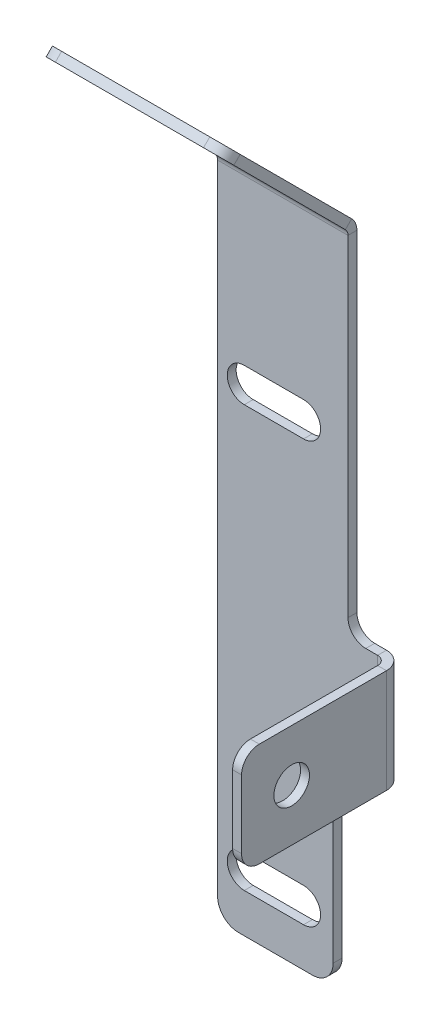
from build123d import *

# Parameters (mm, degrees)
BASE_FLANGE1_DEPTH     = 3
CUT_EXTRUDE1_DEPTH     = 10
SKETCHED_START         = 179.903820644
SKETCHED_BEND1_DEPTH   = 9.096179356
SKETCHED_START_2       = -37
SKETCHED_BEND1_2_DEPTH = 62
SKETCHED_START_3       = -19
SKETCHED_BEND1_3_DEPTH = 44
SKETCHED_START_4       = -10.35
SKETCHED_BEND1_4_DEPTH = 20
SKETCHED_START_5       = -31
SKETCHED_BEND1_5_DEPTH = 12.65
SKETCHED_START_6       = 17.65
SKETCHED_BEND1_6_DEPTH = 1.35
SKETCHED_START_7       = 142.46468863
SKETCHED_BEND1_7_DEPTH = 2.999999999
SKETCHED_START_8       = 50.5
SKETCHED_BEND2_DEPTH   = 35
SKETCHED_BEND2_2_DEPTH = 35
SKETCHED_START_9       = 31
SKETCHED_BEND2_3_DEPTH = 11
SKETCH9_R              = 6
CUT_EXTRUDE2_DEPTH     = 10
CUT_EXTRUDE3_DEPTH     = 10


with BuildPart() as part:
    # Base-Flange1: sheet metal written as solids
    # Sketch1 → Base-Flange1 (new body)
    with BuildSketch(Plane(origin=(0, 0, 0), x_dir=(0, 1, 0), z_dir=(0, 0, 1))):
        with BuildLine():
            Line((-19, 12), (-19, -13))
            ThreePointArc((-19, -13), (-16.949747468, -17.949747468), (-12, -20))
            Line((-12, -20), (43.5, -20))
            ThreePointArc((43.5, -20), (48.449747468, -22.050252532), (50.5, -27))
            Line((50.5, -27), (50.5, -85))
            ThreePointArc((50.5, -85), (52.257359313, -89.242640687), (56.5, -91))
            Line((56.5, -91), (79.5, -91))
            ThreePointArc((79.5, -91), (83.742640687, -89.242640687), (85.5, -85))
            Line((85.5, -85), (85.5, -31))
            ThreePointArc((85.5, -31), (87.257359313, -26.757359313), (91.5, -25))
            Line((91.5, -25), (260, -25))
            ThreePointArc((260, -25), (264.242640687, -23.242640687), (266, -19))
            Line((266, -19), (266, 31))
            ThreePointArc((266, 31), (264.242640687, 35.242640687), (260, 37))
            Line((260, 37), (240.82, 37))
            ThreePointArc((240.82, 37), (236.577359313, 35.242640687), (234.82, 31))
            Line((234.82, 31), (234.82, 25))
            ThreePointArc((234.82, 25), (233.062640687, 20.757359313), (228.82, 19))
            Line((228.82, 19), (-12, 19))
            ThreePointArc((-12, 19), (-16.949747468, 16.949747468), (-19, 12))
        make_face()
    extrude(amount=BASE_FLANGE1_DEPTH)

    # Sketch6 → Cut-Extrude1 (cut)
    with BuildSketch(Plane.XY.offset(3)):
        with BuildLine():
            Line((9.65, 243), (9.65, 258))
            ThreePointArc((9.65, 258), (13.65, 262), (17.65, 258))
            Line((17.65, 258), (17.65, 243))
            ThreePointArc((17.65, 243), (13.65, 239), (9.65, 243))
        make_face()
        with BuildLine():
            Line((-18.35, 243), (-18.35, 258))
            ThreePointArc((-18.35, 258), (-14.35, 262), (-10.35, 258))
            Line((-10.35, 258), (-10.35, 243))
            ThreePointArc((-10.35, 243), (-14.35, 239), (-18.35, 243))
        make_face()
    extrude(amount=-CUT_EXTRUDE1_DEPTH, mode=Mode.SUBTRACT)

    # Sketched Bend1: read off the stored shape, not the designer's step
    # Sketched Bend1 outline → Sketched Bend1 (cut)
    with BuildSketch(Plane(origin=(0, 0, 0), x_dir=(1, 0, 0), z_dir=(0, 0.707106781186549, -0.707106781186546)).offset(SKETCHED_START)):
        with BuildLine():
            Line((9.65, -184.182824136), (9.65, -199.182824136))
            ThreePointArc((9.65, -199.182824136), (13.65, -203.182824136), (17.65, -199.182824136))
            Line((17.65, -199.182824136), (17.65, -184.182824136))
            ThreePointArc((17.65, -184.182824136), (13.65, -180.182824136), (9.65, -184.182824136))
        make_face()
        with BuildLine():
            Line((-18.35, -184.182824136), (-18.35, -199.182824136))
            ThreePointArc((-18.35, -199.182824136), (-14.35, -203.182824136), (-10.35, -199.182824136))
            Line((-10.35, -199.182824136), (-10.35, -184.182824136))
            ThreePointArc((-10.35, -184.182824136), (-14.35, -180.182824136), (-18.35, -184.182824136))
        make_face()
    extrude(amount=SKETCHED_BEND1_DEPTH, mode=Mode.SUBTRACT)

    # Sketched Bend1 2 outline → Sketched Bend1 2 (cut)
    with BuildSketch(Plane.YZ.offset(SKETCHED_START_2)):
        with BuildLine():
            Line((208.718135506, 3), (207.475494819, 1.757359313))
            ThreePointArc((207.475494819, 1.757359313), (205.528954726, 0.456722805), (203.232854132, 0))
            Line((203.232854132, 0), (266, 0))
            Line((266, 0), (266, 3))
            Line((266, 3), (208.718135506, 3))
        make_face()
    extrude(amount=SKETCHED_BEND1_2_DEPTH, mode=Mode.SUBTRACT)

    # Sketched Bend1 3 outline → Sketched Bend1 3 (add)
    with BuildSketch(Plane.YZ.offset(SKETCHED_START_3)):
        with BuildLine():
            Line((225.190537865, 23.715043045), (205.354174476, 3.878679656))
            ThreePointArc((205.354174476, 3.878679656), (204.380904429, 3.228361402), (203.232854132, 3))
            Line((203.232854132, 3), (208.718135506, 3))
            Line((208.718135506, 3), (227.311858208, 21.593722702))
            Line((227.311858208, 21.593722702), (225.190537865, 23.715043045))
        make_face()
    extrude(amount=SKETCHED_BEND1_3_DEPTH)

    # Sketched Bend1 4 outline → Sketched Bend1 4 (add)
    with BuildSketch(Plane.YZ.offset(SKETCHED_START_4)):
        Polygon((247.238127302, 45.762632482), (225.190537865, 23.715043045), (227.311858208, 21.593722702), (249.359447645, 43.641312139), align=None)
    extrude(amount=SKETCHED_BEND1_4_DEPTH)

    # Sketched Bend1 5 outline → Sketched Bend1 5 (add)
    with BuildSketch(Plane.YZ.offset(SKETCHED_START_5)):
        Polygon((247.238127302, 45.762632482), (225.190537865, 23.715043045), (227.311858208, 21.593722702), (249.359447645, 43.641312139), align=None)
    extrude(amount=SKETCHED_BEND1_5_DEPTH)

    # Sketched Bend1 6 outline → Sketched Bend1 6 (add)
    with BuildSketch(Plane.YZ.offset(SKETCHED_START_6)):
        Polygon((247.238127302, 45.762632482), (225.190537865, 23.715043045), (227.311858208, 21.593722702), (249.359447645, 43.641312139), align=None)
    extrude(amount=SKETCHED_BEND1_6_DEPTH)

    # Sketched Bend1 7 outline → Sketched Bend1 7 (add)
    with BuildSketch(Plane(origin=(0, 0, 0), x_dir=(1, 0, 0), z_dir=(0, 0.707106781186549, -0.707106781186546)).offset(SKETCHED_START_7)):
        with BuildLine():
            ThreePointArc((-19, -170.002824136), (-20.757359313, -174.245464823), (-25, -176.002824136))
            Line((-25, -176.002824136), (-19, -176.002824137))
            Line((-19, -176.002824137), (-19, -170.002824136))
        make_face()
        with BuildLine():
            ThreePointArc((-37, -201.182824136), (-35.242640687, -205.425464823), (-31, -207.182824136))
            Line((-31, -207.182824136), (-31, -176.002824136))
            ThreePointArc((-31, -176.002824136), (-35.242640687, -177.760183449), (-37, -182.002824136))
            Line((-37, -182.002824136), (-37, -201.182824136))
        make_face()
        with BuildLine():
            Line((-18.35, -207.182824136), (-10.35, -207.182824136))
            Line((-10.35, -207.182824136), (-10.35, -199.182824136))
            ThreePointArc((-10.35, -199.182824136), (-14.35, -203.182824136), (-18.35, -199.182824136))
            Line((-18.35, -199.182824136), (-18.35, -207.182824136))
        make_face()
        with BuildLine():
            Line((9.65, -207.182824136), (17.65, -207.182824136))
            Line((17.65, -207.182824136), (17.65, -199.182824136))
            ThreePointArc((17.65, -199.182824136), (13.65, -203.182824136), (9.65, -199.182824136))
            Line((9.65, -199.182824136), (9.65, -207.182824136))
        make_face()
        with BuildLine():
            Line((25, -201.182824136), (25, -176.002824137))
            Line((25, -176.002824137), (19, -176.002824137))
            Line((19, -176.002824137), (19, -207.182824136))
            ThreePointArc((19, -207.182824136), (23.242640687, -205.425464823), (25, -201.182824136))
        make_face()
        with BuildLine():
            ThreePointArc((9.65, -184.182824136), (13.65, -180.182824136), (17.65, -184.182824136))
            Line((17.65, -184.182824136), (17.65, -176.002824137))
            Line((17.65, -176.002824137), (9.65, -176.002824137))
            Line((9.65, -176.002824137), (9.65, -184.182824136))
        make_face()
        with BuildLine():
            ThreePointArc((-18.35, -184.182824136), (-14.35, -180.182824136), (-10.35, -184.182824136))
            Line((-10.35, -184.182824136), (-10.35, -176.002824137))
            Line((-10.35, -176.002824137), (-18.35, -176.002824137))
            Line((-18.35, -176.002824137), (-18.35, -184.182824136))
        make_face()
    extrude(amount=SKETCHED_BEND1_7_DEPTH)

    # Sketched Bend2: read off the stored shape, not the designer's step
    # Sketched Bend2 outline → Sketched Bend2 (cut)
    with BuildSketch(Plane(origin=(0, 0, 0), x_dir=(1, 0, 0), z_dir=(0, 1, 0)).offset(SKETCHED_START_8)):
        with BuildLine():
            ThreePointArc((35, 0), (38, -0.803847577), (40.196152423, -3))
            Line((40.196152423, -3), (91, -3))
            Line((91, -3), (91, 0))
            Line((91, 0), (35, 0))
        make_face()
    extrude(amount=SKETCHED_BEND2_DEPTH, mode=Mode.SUBTRACT)

    # Sketched Bend2 2 outline → Sketched Bend2 2 (add)
    with BuildSketch(Plane(origin=(0, 0, 0), x_dir=(1, 0, 0), z_dir=(0, 1, 0)).offset(SKETCHED_START_8)):
        with BuildLine():
            ThreePointArc((35, -3), (37.121320344, -3.878679656), (38, -6))
            Line((38, -6), (38, -54.931416529))
            Line((38, -54.931416529), (41, -54.931416529))
            Line((41, -54.931416529), (41, -6))
            ThreePointArc((41, -6), (40.795554958, -4.447085729), (40.196152423, -3))
            Line((40.196152423, -3), (35, -3))
        make_face()
    extrude(amount=SKETCHED_BEND2_2_DEPTH)

    # Sketched Bend2 3 outline → Sketched Bend2 3 (cut)
    with BuildSketch(Plane.YZ.offset(SKETCHED_START_9)):
        with BuildLine():
            ThreePointArc((50.5, 48.931416529), (52.257359313, 53.174057216), (56.5, 54.931416529))
            Line((56.5, 54.931416529), (50.5, 54.931416529))
            Line((50.5, 54.931416529), (50.5, 48.931416529))
        make_face()
        with BuildLine():
            ThreePointArc((79.5, 54.931416529), (83.742640687, 53.174057217), (85.5, 48.931416529))
            Line((85.5, 48.931416529), (85.5, 54.931416529))
            Line((85.5, 54.931416529), (79.5, 54.931416529))
        make_face()
    extrude(amount=SKETCHED_BEND2_3_DEPTH, mode=Mode.SUBTRACT)

    # Sketch9 → Cut-Extrude2 (cut)
    with BuildSketch(Plane.YZ.offset(41)):
        with Locations(Location((68, 38, 0), (0, 0, 270))):
            Circle(SKETCH9_R)
    extrude(amount=-CUT_EXTRUDE2_DEPTH, mode=Mode.SUBTRACT)

    # Sketch10 → Cut-Extrude3 (cut)
    with BuildSketch(Plane.XY.offset(3)):
        with BuildLine():
            Line((-10, 5.75), (10, 5.75))
            ThreePointArc((10, 5.75), (15.75, 0), (10, -5.75))
            Line((10, -5.75), (-10, -5.75))
            ThreePointArc((-10, -5.75), (-15.75, 0), (-10, 5.75))
        make_face()
        with BuildLine():
            Line((-10, 147.75), (10, 147.75))
            ThreePointArc((10, 147.75), (15.75, 142), (10, 136.25))
            Line((10, 136.25), (-10, 136.25))
            ThreePointArc((-10, 136.25), (-15.75, 142), (-10, 147.75))
        make_face()
    extrude(amount=-CUT_EXTRUDE3_DEPTH, mode=Mode.SUBTRACT)


solid = part.part
